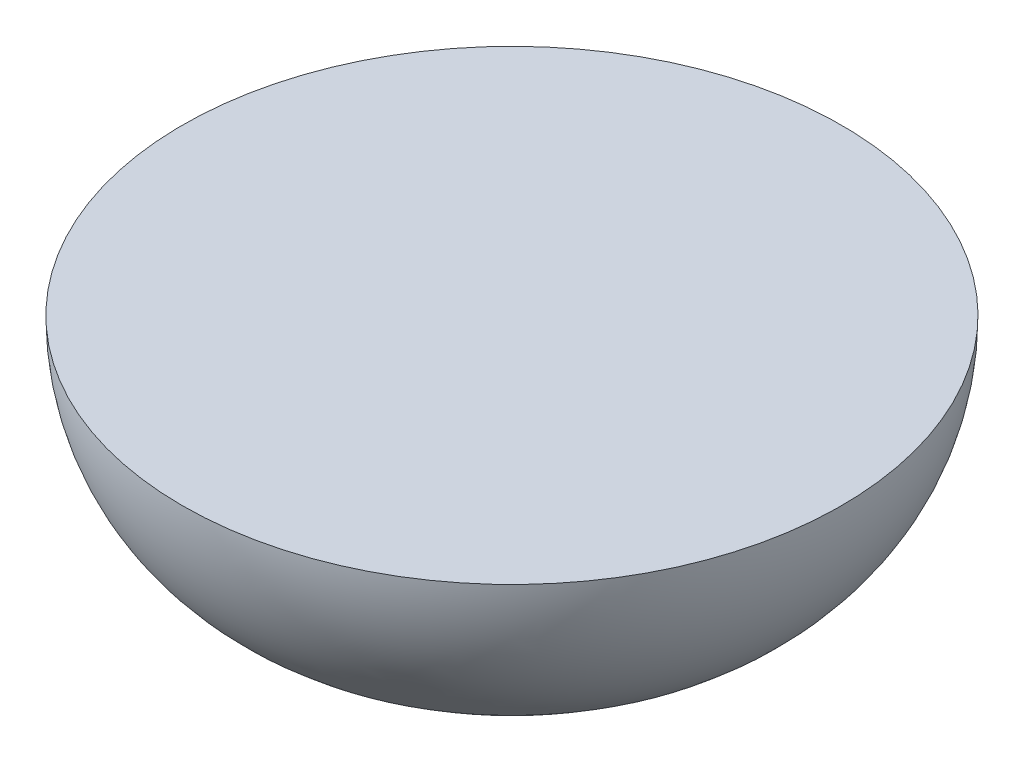
from build123d import *

# Parameters (mm, degrees)
SKETCH1_R           = 15
BOSS_EXTRUDE1_DEPTH = 10
SKETCH2_R           = 3.9
CUT_EXTRUDE1_DEPTH  = 7
FILLET1_R           = 10


with BuildPart() as part:
    # Sketch1 → Boss-Extrude1 (new body)
    with BuildSketch(Plane(origin=(0, 0, 0), x_dir=(1, 0, 0), z_dir=(0, 1, 0))):
        with Locations(Location((0, 0, 0), (0, 0, 270))):
            Circle(SKETCH1_R)
    extrude(amount=BOSS_EXTRUDE1_DEPTH)

    # Sketch2 → Cut-Extrude1 (cut)
    with BuildSketch(Plane.XZ):
        with Locations(Location((0, 0, 0), (0, 0, 270))):
            Circle(SKETCH2_R)
    extrude(amount=-CUT_EXTRUDE1_DEPTH, mode=Mode.SUBTRACT)

    # Fillet1
    fillet1_edges = [part.edges().sort_by_distance(p)[0] for p in [
        (0, 0, -15),
    ]]
    fillet(fillet1_edges, radius=FILLET1_R - 0.0001)  # a hair under: the kernel refuses the full size


solid = part.part
